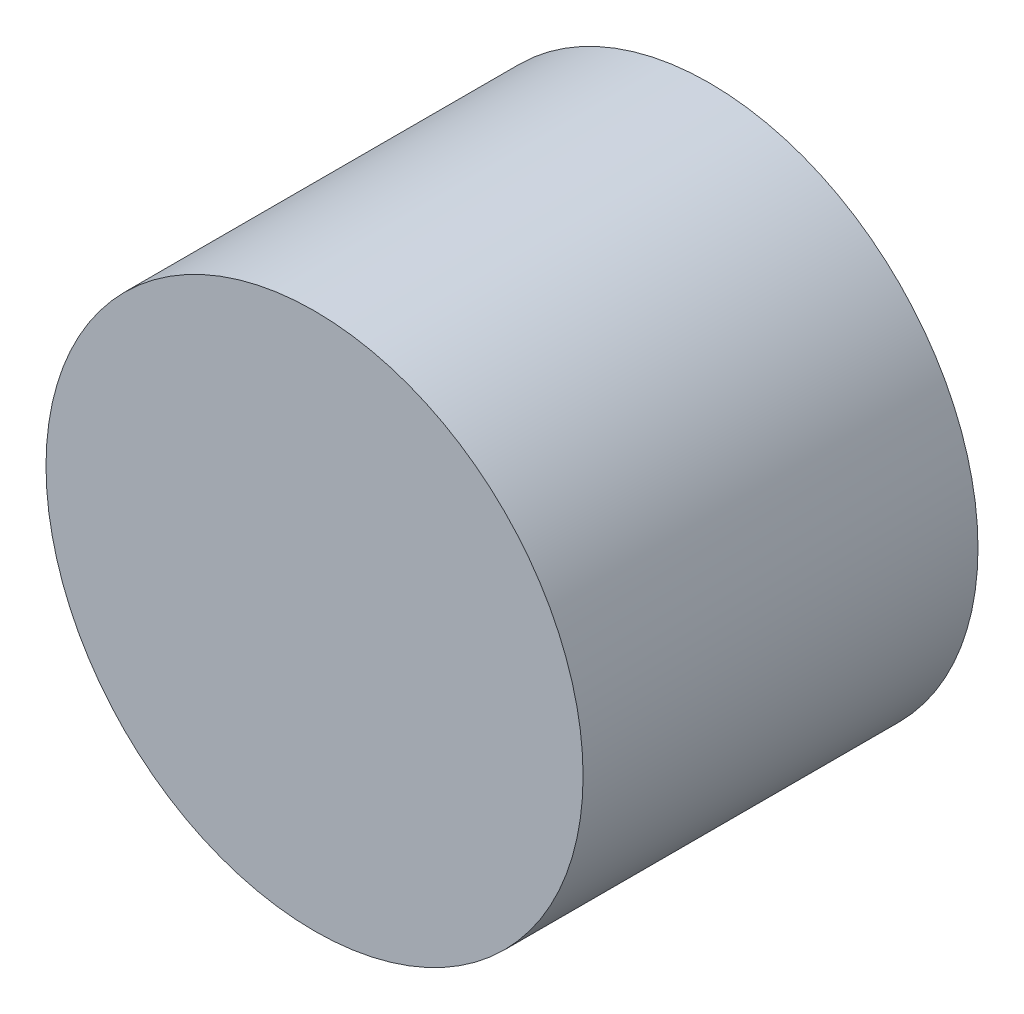
from build123d import *

# Parameters (mm, degrees)
SKETCH2_R           = 8.5
BOSS_EXTRUDE1_DEPTH = 12.5


with BuildPart() as part:
    # Sketch2 → Boss-Extrude1 (new body)
    with BuildSketch(Plane.XY):
        Circle(SKETCH2_R)
    extrude(amount=BOSS_EXTRUDE1_DEPTH)


solid = part.part
